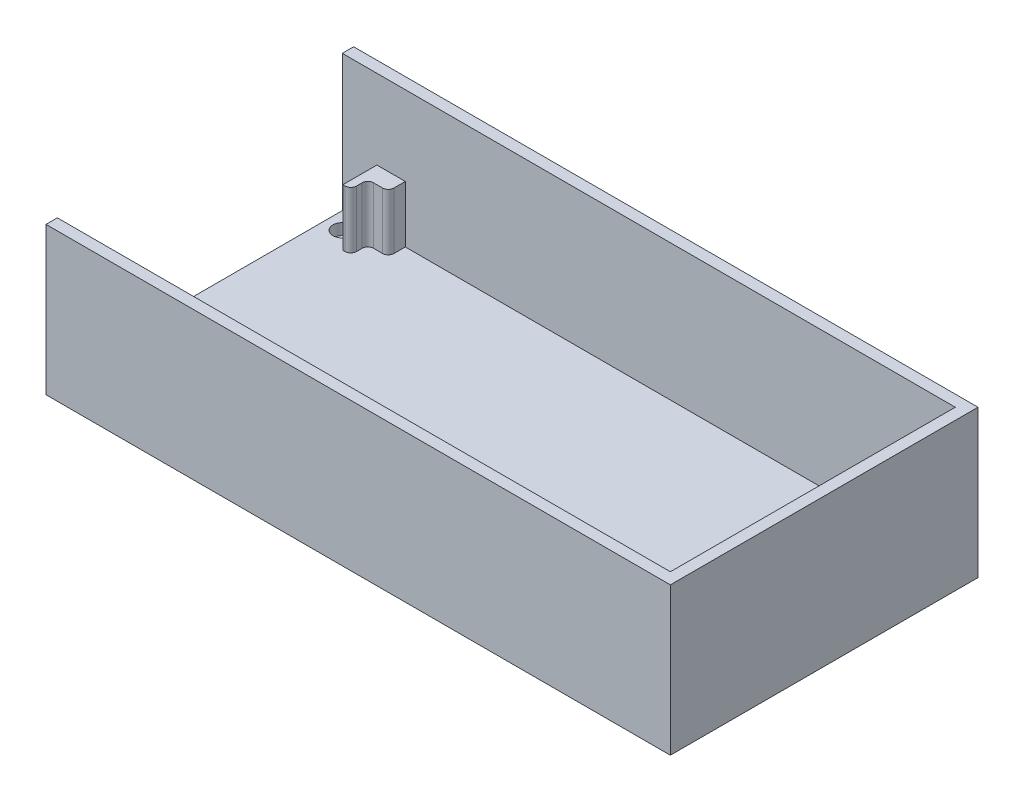
from build123d import *

# Parameters (mm, degrees)
SKETCH_1_W          = 112
SKETCH_1_H          = 54.2
SKETCH_1_W_2        = 108
SKETCH_1_H_2        = 50.2
EXTRUDE_1_DEPTH     = 26
SKETCH_2_W          = 108
SKETCH_2_H          = 50.2
SKETCH_2_R          = 1.65
EXTRUDE_2_DEPTH     = 2
EXTRUDE_3_DEPTH     = 10
SKETCH_9_R          = 3.5
SKETCH_9_W          = 20
SKETCH_9_H          = 10
CUT_EXTRUDE_2_DEPTH = 2
FILLET_2_R          = 2
SKETCH_10_W         = 54.2
SKETCH_10_H         = 26
CUT_EXTRUDE_3_DEPTH = 2
FILLET_3_R          = 1


with BuildPart() as part:
    # 草图1 → 凸台-拉伸1 (new body)
    with BuildSketch(Plane(origin=(0, 0, 0), x_dir=(1, 0, 0), z_dir=(0, 1, 0))):
        Rectangle(SKETCH_1_W, SKETCH_1_H)
        Rectangle(SKETCH_1_W_2, SKETCH_1_H_2, mode=Mode.SUBTRACT)
    extrude(amount=EXTRUDE_1_DEPTH)

    # 草图2 → 凸台-拉伸2 (add)
    with BuildSketch(Plane(origin=(0, 0, 0), x_dir=(1, 0, 0), z_dir=(0, 1, 0))):
        Rectangle(SKETCH_2_W, SKETCH_2_H)
        with Locations(Location((-51, 22.1, 0), (0, 0, 270))):
            Circle(SKETCH_2_R, mode=Mode.SUBTRACT)
        with Locations(Location((51, 22.1, 0), (0, 0, 90))):
            Circle(SKETCH_2_R, mode=Mode.SUBTRACT)
        with Locations(Location((51, -22.1, 0), (0, 0, 270))):
            Circle(SKETCH_2_R, mode=Mode.SUBTRACT)
        with Locations(Location((-51, -22.1, 0), (0, 0, 90))):
            Circle(SKETCH_2_R, mode=Mode.SUBTRACT)
    extrude(amount=EXTRUDE_2_DEPTH)

    # 草图6 → 凸台-拉伸3 (add)
    with BuildSketch(Plane(origin=(0, 2, 0), x_dir=(1, 0, 0), z_dir=(0, 1, 0))):
        Polygon((-47.9, 25.1), (-47.9, 19.1), (-46.5, 19.1), (-46.5, 22.1), (-42.9, 22.1), (-42.9, 25.1), align=None)
        Polygon((46.5, 19.1), (46.5, 22.1), (42.9, 22.1), (42.9, 25.1), (47.9, 25.1), (47.9, 19.1), align=None)
        Polygon((47.9, -25.1), (47.9, -19.1), (46.5, -19.1), (46.5, -22.1), (42.9, -22.1), (42.9, -25.1), align=None)
        Polygon((-42.9, -25.1), (-47.9, -25.1), (-47.9, -19.1), (-46.5, -19.1), (-46.5, -22.1), (-42.9, -22.1), align=None)
    extrude(amount=EXTRUDE_3_DEPTH)

    # 草图9 → 切除-拉伸2 (cut)
    with BuildSketch(Plane.ZY.offset(56)):
        with Locations((-16, 6)):
            Circle(SKETCH_9_R)
        with Locations((10.1, 16)):
            Rectangle(SKETCH_9_W, SKETCH_9_H)
    extrude(amount=-CUT_EXTRUDE_2_DEPTH, mode=Mode.SUBTRACT)

    # 圆角2
    fillet_2_edges = [part.edges().sort_by_distance(p)[0] for p in [
        (-56, 16, 20.1),
        (-56, 21, 10.1),
        (-56, 16, 0.1),
        (-56, 11, 10.1),
        (-56, 6, -19.5),
    ]]
    fillet(fillet_2_edges, radius=FILLET_2_R - 0.0001)  # a hair under: the kernel refuses the full size

    # 草图10 → 切除-拉伸3 (cut)
    with BuildSketch(Plane.ZY.offset(56)):
        with Locations((0, 13)):
            Rectangle(SKETCH_10_W, SKETCH_10_H)
    extrude(amount=-CUT_EXTRUDE_3_DEPTH, mode=Mode.SUBTRACT)

    # 圆角3
    fillet_3_edges = [part.edges().sort_by_distance(p)[0] for p in [
        (-42.9, 7, 22.1),
        (-46.5, 7, 22.1),
        (-46.5, 7, 19.1),
        (-46.5, 7, -19.1),
        (-46.5, 7, -22.1),
        (-42.9, 7, -22.1),
        (42.9, 7, -22.1),
        (46.5, 7, -22.1),
        (46.5, 7, -19.1),
        (46.5, 7, 19.1),
        (46.5, 7, 22.1),
        (42.9, 7, 22.1),
    ]]
    fillet(fillet_3_edges, radius=FILLET_3_R)


solid = part.part
